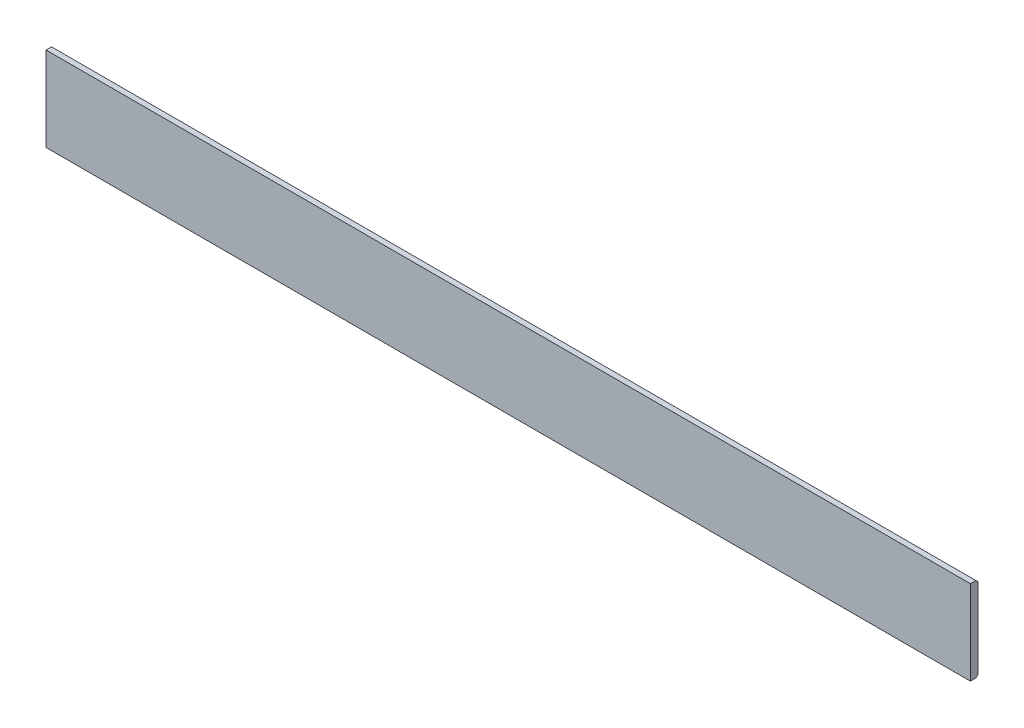
from build123d import *

# Parameters (mm, degrees)
SKETCH_1_W             = 2190
SKETCH_1_H             = 200
SM_BASE_FLANGE_1_DEPTH = 18
CHAMFER_1_SIZE         = 5


# Sheet-metal steps are written as plain solids
with BuildPart() as part:
    # Sketch 1 → 基体-法兰1 (new body)
    with BuildSketch(Plane.XY):
        Rectangle(SKETCH_1_W, SKETCH_1_H)
    extrude(amount=-SM_BASE_FLANGE_1_DEPTH)

    # 倒角1
    chamfer_1_edges = [part.edges().sort_by_distance(p)[0] for p in [
        (0, -100, -18),
        (0, 100, -18),
    ]]
    chamfer(chamfer_1_edges, length=CHAMFER_1_SIZE)


solid = part.part
